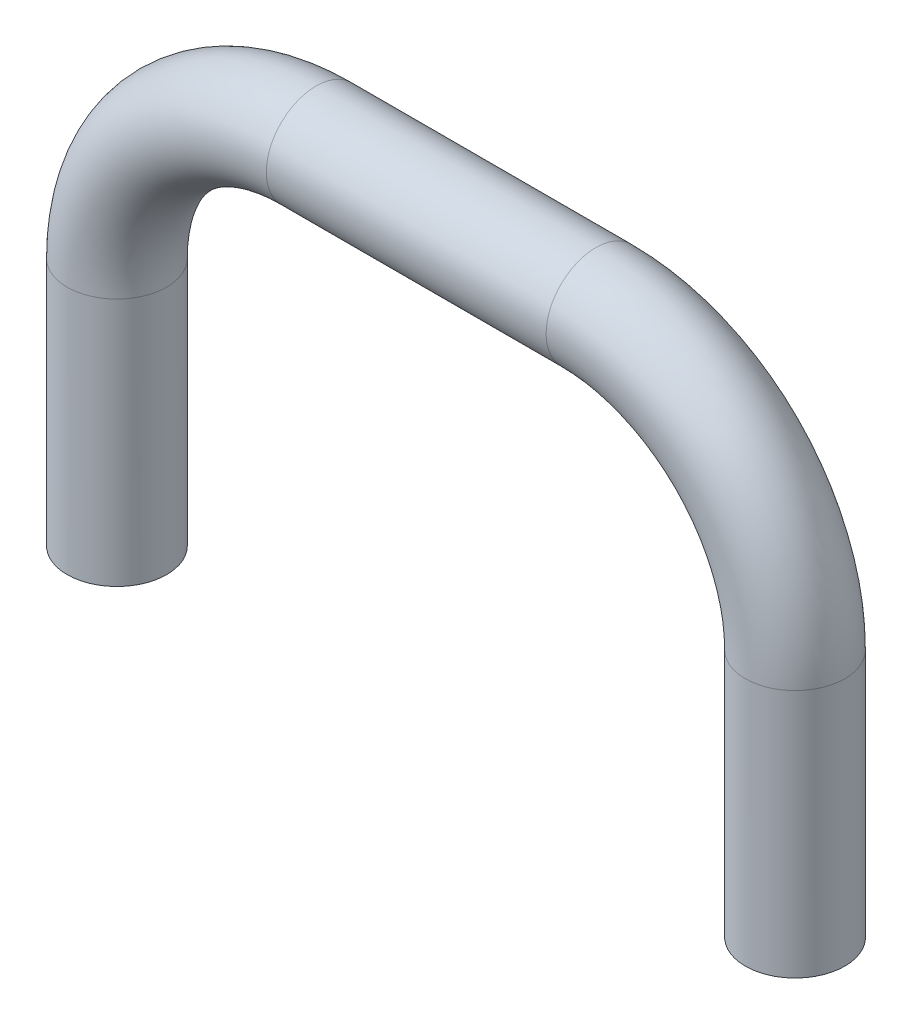
from build123d import *

# Parameters (mm, degrees)
SKETCH_2_R            = 5
HOLE_WIZARD_M51_D     = 5.2
HOLE_WIZARD_M51_DEPTH = 10
HOLE_WIZARD_M51_TIP   = 1.562237609


with BuildPart() as part:
    # По траектории1: sweep along a path in Эскиз1
    with BuildLine(Plane.XY) as sweep_1_path:
        Line((0, 0), (0, 25))
        ThreePointArc((0, 25), (5.857864376, 39.142135624), (20, 45))
        Line((20, 45), (48.1, 45))
        ThreePointArc((48.1, 45), (62.242135624, 39.142135624), (68.1, 25))
        Line((68.1, 25), (68.1, 0))
    # Эскиз2 → По траектории1 (sweep)
    with BuildSketch(Plane(origin=(0, 0, 0), x_dir=(1, 0, 0), z_dir=(0, 1, 0))):
        Circle(SKETCH_2_R)
    sweep(path=sweep_1_path.line)

    # Сверло под метчик  спиральное M51
    with Locations(Plane(origin=(0, 0, 0), x_dir=(-1, 0, 0), z_dir=(0, -1, 0))):
        with Locations((0, 0), (-68.1, 0)):
            Hole(HOLE_WIZARD_M51_D / 2, depth=HOLE_WIZARD_M51_DEPTH)
            with Locations((0, 0, -(HOLE_WIZARD_M51_DEPTH + HOLE_WIZARD_M51_TIP / 2))):  # 118° drill point
                Cone(0, HOLE_WIZARD_M51_D / 2, HOLE_WIZARD_M51_TIP, mode=Mode.SUBTRACT)


solid = part.part
